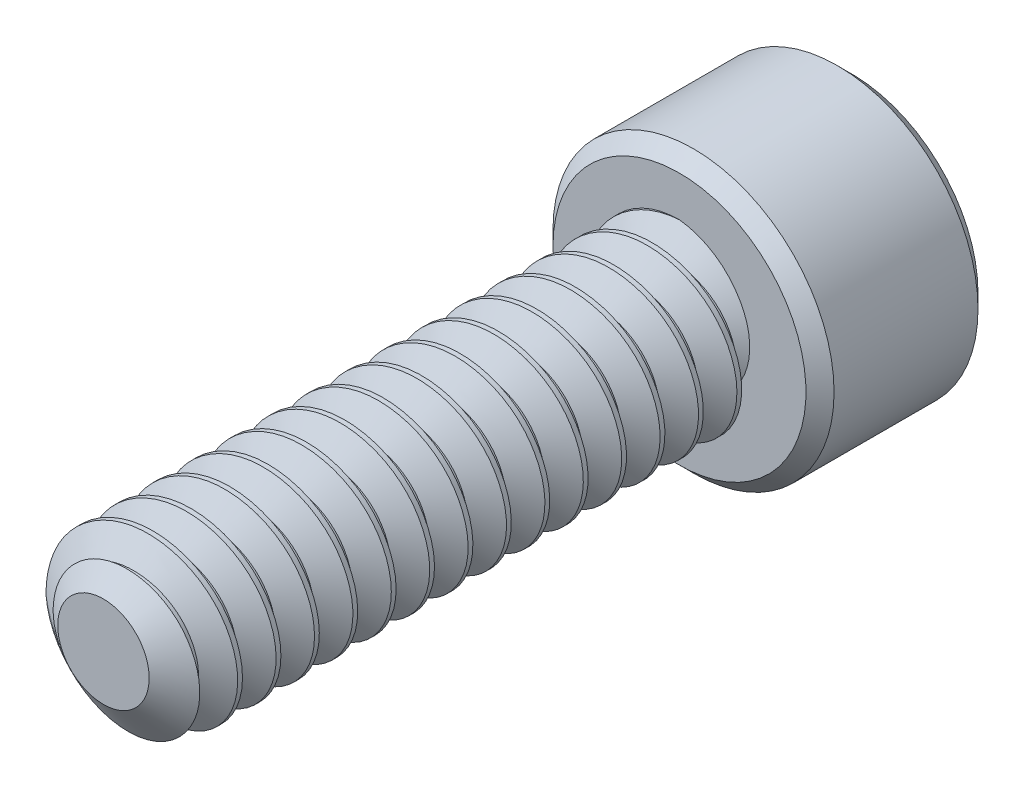
from build123d import *

# Parameters (mm, degrees)
SKETCH1_R          = 1.4224
EXTRUDE1_DEPTH     = 9.525
CUT_SWEEP1_PITCH   = 0.635
SKETCH6_R          = 2.3241
EXTRUDE2_DEPTH     = 2.8448
CUT_EXTRUDE1_DEPTH = 1.7859375
CHAMFER1_SIZE      = 0.23241


with BuildPart() as part:
    # Sketch1 → Extrude1 (new body)
    with BuildSketch(Plane.XY):
        Circle(SKETCH1_R)
    extrude(amount=-EXTRUDE1_DEPTH)

    # Cut-Sweep1: the profile of Sketch3 profile screwed along a right-hand helix of 16 turns, 6 arcs to a turn; built about Z, then put on its axis
    cut_sweep1_z = Axis((0, 0, 0), (0, 0, 1))
    cut_sweep1_corners = [(1.4227, 0, -0.555798205), (1.009955401, 0, -0.3175), (1.009955401, 0, -0.238125), (1.4227, 0, 0.000173205)]
    with BuildLine(mode=Mode.PRIVATE) as cut_sweep1_profile:
        Line(cut_sweep1_corners[0], cut_sweep1_corners[1])
        Line(cut_sweep1_corners[1], cut_sweep1_corners[2])
        Line(cut_sweep1_corners[2], cut_sweep1_corners[3])
        Line(cut_sweep1_corners[3], cut_sweep1_corners[0])
    cut_sweep1_cap = Face(cut_sweep1_profile.wire())
    cut_sweep1_turn_angles = [0, 30, 60, 90, 120, 150, 180, 210, 240, 270, 300, 330, 360]
    cut_sweep1_turn_weights = [1, 0.8660254037844387, 1, 0.8660254037844387, 1, 0.8660254037844387, 1, 0.8660254037844387, 1, 0.8660254037844387, 1, 0.8660254037844387, 1]
    cut_sweep1_turn_rails = [Edge.make_bspline([Vector(p[0], p[1], 0).rotate(cut_sweep1_z, cut_sweep1_turn_angles[k]) / cut_sweep1_turn_weights[k] + Vector(0, 0, p[2] + CUT_SWEEP1_PITCH * cut_sweep1_turn_angles[k] / 360) for k in range(13)], [0, 0, 0, 1, 1, 2, 2, 3, 3, 4, 4, 5, 5, 6, 6, 6], 2, cut_sweep1_turn_weights) for p in cut_sweep1_corners]
    cut_sweep1_turn_sides = [Face.make_surface_from_curves(cut_sweep1_turn_rails[p[0]], cut_sweep1_turn_rails[p[1]]) for p in [(0, 1), (1, 2), (2, 3), (3, 0)]]
    cut_sweep1 = Plane(origin=(0, 0, 0), x_dir=(0, 1, 0), z_dir=(0, 0, -1)) * Solid(Shell([*[p.moved(Location((0, 0, CUT_SWEEP1_PITCH * i))) for i in range(16) for p in cut_sweep1_turn_sides], cut_sweep1_cap, cut_sweep1_cap.rotate(cut_sweep1_z, 5760).moved(Location((0, 0, CUT_SWEEP1_PITCH * 5760 / 360)))]))
    add(cut_sweep1, mode=Mode.SUBTRACT)

    # Sketch4 → Cut-Revolve1 (revolve, cut)
    with BuildSketch(Plane(origin=(0, 0, 0), x_dir=(0, 0, -1), z_dir=(1, 0, 0)), mode=Mode.PRIVATE) as cut_revolve1_sk:
        Polygon((0.466649532, 1.4224), (0, 0.755955401), (0, 1.4224), align=None)
    revolve(cut_revolve1_sk.sketch.rotate(Axis((0, 0, 0), (0, 0, -1)), 264.795368264), axis=Axis((0, 0, 0), (0, 0, -1)), mode=Mode.SUBTRACT)

    # Sketch6 → Extrude2 (add)
    with BuildSketch(Plane(origin=(0, 0, -9.525), x_dir=(-1, 0, 0), z_dir=(0, 0, -1))):
        Circle(SKETCH6_R)
    extrude(amount=EXTRUDE2_DEPTH)

    # Sketch7 → Cut-Extrude1 (cut)
    with BuildSketch(Plane(origin=(0, 0, -12.3698), x_dir=(-1, 0, 0), z_dir=(0, 0, -1))):
        Polygon((0, 1.374815329), (-1.190625, 0.687407664), (-1.190625, -0.687407664), (0, -1.374815329), (1.190625, -0.687407664), (1.190625, 0.687407664), align=None)
    extrude(amount=-CUT_EXTRUDE1_DEPTH, mode=Mode.SUBTRACT)

    # Cut-Extrude2 cone 1 section (through the dimple's axis) → Cut-Extrude2 (revolve, cut)
    with BuildSketch(Plane(origin=(0, 0, -12.3698), x_dir=(0, 1, 0), z_dir=(1, 0, 0))):
        Polygon((0, 0), (1.374815329, 0), (0, 1.374815329), align=None)
    revolve(axis=Axis((0, 0, -12.3698), (0, 0, 1)), mode=Mode.SUBTRACT)

    # Chamfer1
    chamfer1_edges = [part.edges().sort_by_distance(p)[0] for p in [
        (2.3241, 0, -9.525),
        (2.3241, 0, -12.3698),
    ]]
    chamfer(chamfer1_edges, length=CHAMFER1_SIZE)


solid = part.part
